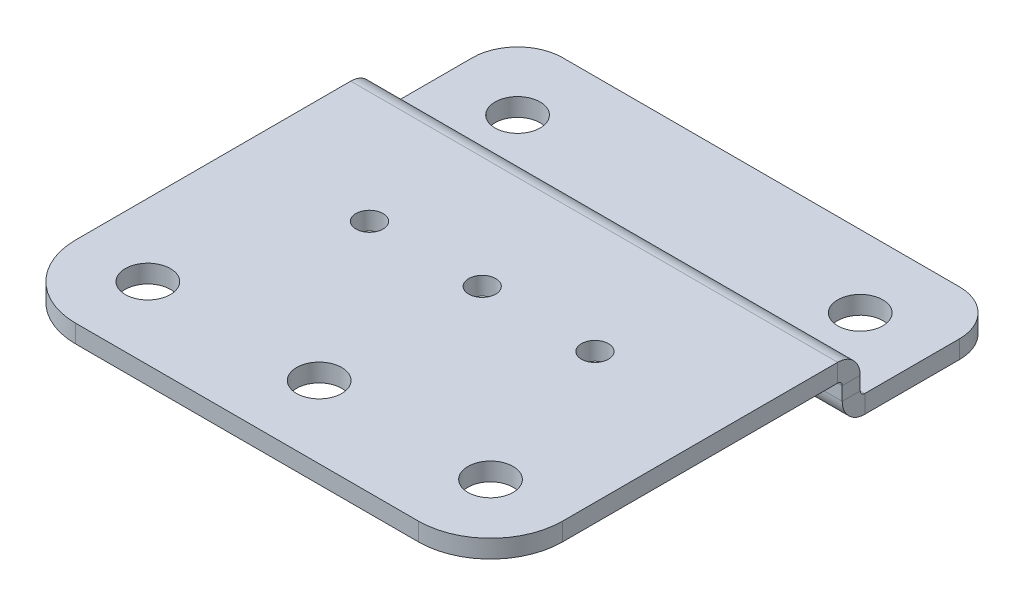
from build123d import *

# Parameters (mm, degrees)
SKETCH1_R                    = 2.5
BASE_FLANGE1_DEPTH           = 2
EDGE_FLANGE1_STRIP_W         = 9
EDGE_FLANGE1_STRIP_H         = 2
EDGE_FLANGE1_STRIP_CUT_DEPTH = 54
EDGE_FLANGE1_DEPTH           = 54
EDGE_FLANGE2_DEPTH           = 54
SKETCH25_R                   = 2.5
CUT_EXTRUDE1_DEPTH           = 69.112040052
SKETCH26_R                   = 1.5
CUT_EXTRUDE2_DEPTH           = 2


# Sheet-metal steps are written as plain solids
with BuildPart() as part:
    # Sketch1 → Base-Flange1 (new body)
    with BuildSketch(Plane(origin=(0, 0, 0), x_dir=(1, 0, 0), z_dir=(0, 1, 0))):
        with BuildLine():
            Line((0, 0), (54, 0))
            Line((54, 0), (54, 11))
            ThreePointArc((54, 11), (52.535533906, 14.535533906), (49, 16))
            Line((49, 16), (5, 16))
            ThreePointArc((5, 16), (1.464466094, 14.535533906), (0, 11))
            Line((0, 11), (0, 0))
        make_face()
        with Locations(Location((8, 8, 0), (0, 0, 270))):
            Circle(SKETCH1_R, mode=Mode.SUBTRACT)
        with Locations(Location((46, 8, 0), (0, 0, 90))):
            Circle(SKETCH1_R, mode=Mode.SUBTRACT)
    extrude(amount=-BASE_FLANGE1_DEPTH)

    # Edge-Flange1 strip (across the edge) → Edge-Flange1 strip cut (cut)
    with BuildSketch(Plane(origin=(0, 0, 0), x_dir=(0, 0, -1), z_dir=(1, 0, 0))):
        with Locations((-4, -1)):
            Rectangle(EDGE_FLANGE1_STRIP_W, EDGE_FLANGE1_STRIP_H)
    extrude(amount=EDGE_FLANGE1_STRIP_CUT_DEPTH, mode=Mode.SUBTRACT)

    # Edge-Flange1 section (across the edge) → Edge-Flange1 (add)
    with BuildSketch(Plane(origin=(0, 0, 0), x_dir=(0, 0, -1), z_dir=(1, 0, 0))):
        with BuildLine():
            Line((-2, 0.5), (-2, 2))
            Line((-2, 2), (0, 2))
            Line((0, 2), (0, 0.5))
            ThreePointArc((0, 0.5), (0.146446609, 0.146446609), (0.5, 0))
            Line((0.5, 0), (0.5, -2))
            ThreePointArc((0.5, -2), (-1.267766953, -1.267766953), (-2, 0.5))
        make_face()
    extrude(amount=EDGE_FLANGE1_DEPTH)

    # Edge-Flange2 section (across the edge) → Edge-Flange2 (add)
    with BuildSketch(Plane(origin=(54, 2.5, 2), x_dir=(0, -1, 0), z_dir=(-1, 0, 0))):
        with BuildLine():
            Line((-2, 0.5), (-2, 39))
            Line((-2, 39), (0, 39))
            Line((0, 39), (0, 0.5))
            ThreePointArc((0, 0.5), (0.146446609, 0.146446609), (0.5, 0))
            Line((0.5, 0), (0.5, -2))
            ThreePointArc((0.5, -2), (-1.267766953, -1.267766953), (-2, 0.5))
        make_face()
    extrude(amount=EDGE_FLANGE2_DEPTH)

    # Sketch25 → Cut-Extrude1 (cut, through all)
    with BuildSketch(Plane(origin=(0, 4.5, 0), x_dir=(1, 0, 0), z_dir=(0, 1, 0))):
        with Locations(Location((27, -33, 0), (0, 0, 270))):
            Circle(SKETCH25_R)
        with Locations(Location((8, -33, 0), (0, 0, 270))):
            Circle(SKETCH25_R)
        with BuildLine():
            ThreePointArc((8, -41), (2.343145751, -38.656854249), (0, -33))
            Line((0, -33), (0, -41))
            Line((0, -41), (8, -41))
        make_face()
        with Locations(Location((46, -33, 0), (0, 0, 270))):
            Circle(SKETCH25_R)
        with BuildLine():
            Line((54, -41), (54, -33))
            ThreePointArc((54, -33), (51.656854249, -38.656854249), (46, -41))
            Line((46, -41), (54, -41))
        make_face()
    extrude(amount=-CUT_EXTRUDE1_DEPTH, mode=Mode.SUBTRACT)

    # Sketch26 → Cut-Extrude2 (cut)
    with BuildSketch(Plane(origin=(0, 4.5, 0), x_dir=(1, 0, 0), z_dir=(0, 1, 0))):
        with Locations(Location((39.5, -14.92, 0), (0, 0, 270))):
            Circle(SKETCH26_R)
        with Locations(Location((27, -14.92, 0), (0, 0, 270))):
            Circle(SKETCH26_R)
        with Locations(Location((14.5, -14.92, 0), (0, 0, 270))):
            Circle(SKETCH26_R)
    extrude(amount=-CUT_EXTRUDE2_DEPTH, mode=Mode.SUBTRACT)


solid = part.part
